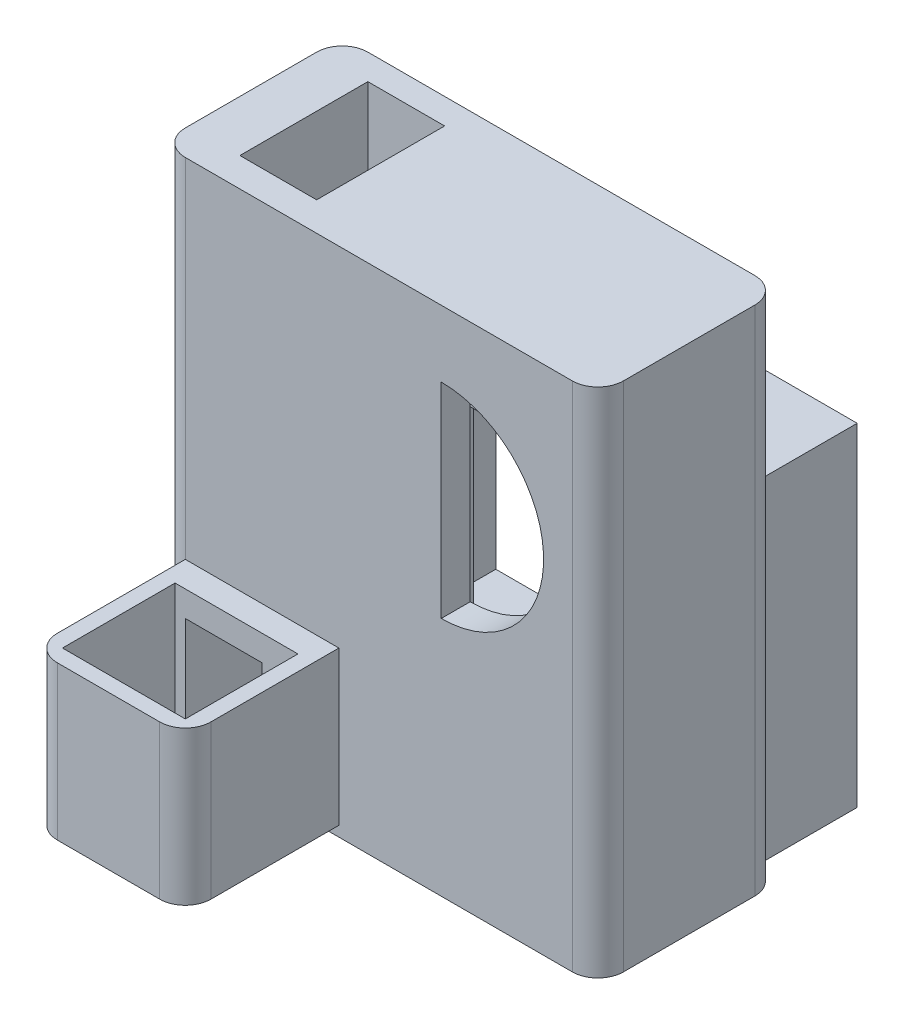
from build123d import *

# Parameters (mm, degrees)
CROQUIS1_W                 = 85.6
CROQUIS1_H                 = 35.66
SALIENTE_EXTRUIR1_DEPTH    = 100
CROQUIS2_W                 = 15
CROQUIS2_H                 = 25
CORTAR_EXTRUIR1_DEPTH      = 92
CROQUIS3_W                 = 30
CROQUIS3_H                 = 30
SALIENTE_EXTRUIR2_DEPTH    = 30
CROQUIS4_W                 = 24
CROQUIS4_H                 = 22
CORTAR_EXTRUIR2_DEPTH      = 30
REDONDEO1_R                = 5
CROQUIS8_W                 = 75.6
CROQUIS8_H                 = 65
SALIENTE_EXTRUIR3_DEPTH    = 20
CORTAR_EXTRUIR3_DEPTH      = 10
CORTAR_EXTRUIR3_DEPTH_BACK = 10
CROQUIS6_W                 = 15
CROQUIS6_H                 = 20
CROQUIS9_W                 = 24
CROQUIS9_H                 = 22
SALIENTE_EXTRUIR4_DEPTH    = 2
SALIENTE_EXTRUIR4_TAPER    = 60
CROQUIS10_W                = 17.07179677
CROQUIS10_H                = 15.07179677
CORTAR_EXTRUIR4_DEPTH      = 2
CORTAR_EXTRUIR4_DRAFT      = 25
CROQUIS12_W                = 65.6
CROQUIS12_H                = 55
CORTAR_EXTRUIR6_DEPTH      = 20
CROQUIS17_W                = 30
CROQUIS17_H                = 55
CORTAR_EXTRUIR11_DEPTH     = 30
CORTAR_EXTRUIR18_DEPTH     = 20
CORTAR_EXTRUIR19_DEPTH     = 5.66
CORTAR_EXTRUIR20_DEPTH     = 20


with BuildPart() as part:
    # Croquis1 → Saliente-Extruir1 (new body)
    with BuildSketch(Plane(origin=(0, 0, 0), x_dir=(1, 0, 0), z_dir=(0, 1, 0))):
        Rectangle(CROQUIS1_W, CROQUIS1_H)
    extrude(amount=SALIENTE_EXTRUIR1_DEPTH)

    # Croquis2 → Cortar-Extruir1 (cut)
    with BuildSketch(Plane(origin=(0, 100, 0), x_dir=(1, 0, 0), z_dir=(0, 1, 0))):
        with Locations((-25.3, 0.33)):
            Rectangle(CROQUIS2_W, CROQUIS2_H)
    extrude(amount=-CORTAR_EXTRUIR1_DEPTH, mode=Mode.SUBTRACT)

    # Croquis3 → Saliente-Extruir2 (add)
    with BuildSketch(Plane.XY.offset(17.83)):
        with Locations((-22.8, 17)):
            Rectangle(CROQUIS3_W, CROQUIS3_H)
    extrude(amount=SALIENTE_EXTRUIR2_DEPTH)

    # Croquis4 → Cortar-Extruir2 (cut)
    with BuildSketch(Plane.XZ.offset(-2)):
        with Locations((-22.8, 33.83)):
            Rectangle(CROQUIS4_W, CROQUIS4_H)
    extrude(amount=-CORTAR_EXTRUIR2_DEPTH, mode=Mode.SUBTRACT)

    # Redondeo1
    redondeo1_edges = [part.edges().sort_by_distance(p)[0] for p in [
        (-7.8, 17, 47.83),
        (-37.8, 17, 47.83),
        (42.8, 50, 17.83),
        (-42.8, 50, 17.83),
        (-42.8, 50, -17.83),
        (42.8, 50, -17.83),
    ]]
    fillet(redondeo1_edges, radius=REDONDEO1_R - 0.0001)  # a hair under: the kernel refuses the full size

    # Croquis8 → Saliente-Extruir3 (add)
    with BuildSketch(Plane(origin=(0, 0, -17.83), x_dir=(-1, 0, 0), z_dir=(0, 0, -1))):
        with Locations((0, 32.5)):
            Rectangle(CROQUIS8_W, CROQUIS8_H)
    extrude(amount=SALIENTE_EXTRUIR3_DEPTH)

    # Croquis6 → Cortar-Extruir3 (cut, two sides: drawn at the far end of the back side and taken through both)
    with BuildSketch(Plane.XY.offset(17.83).offset(-CORTAR_EXTRUIR3_DEPTH_BACK)):
        with Locations((-25.3, 17)):
            Rectangle(CROQUIS6_W, CROQUIS6_H)
    extrude(amount=CORTAR_EXTRUIR3_DEPTH + CORTAR_EXTRUIR3_DEPTH_BACK, mode=Mode.SUBTRACT)

    # Croquis12 → Cortar-Extruir6 (cut)
    with BuildSketch(Plane(origin=(0, 0, -37.83), x_dir=(-1, 0, 0), z_dir=(0, 0, -1))):
        with Locations((0, 32.5)):
            Rectangle(CROQUIS12_W, CROQUIS12_H)
    extrude(amount=-CORTAR_EXTRUIR6_DEPTH, mode=Mode.SUBTRACT)

    # Croquis17 → Cortar-Extruir11 (cut)
    with BuildSketch(Plane(origin=(0, 0, -17.83), x_dir=(-1, 0, 0), z_dir=(0, 0, -1))):
        with Locations((-17.8, 32.5)):
            Rectangle(CROQUIS17_W, CROQUIS17_H)
    extrude(amount=-CORTAR_EXTRUIR11_DEPTH, mode=Mode.SUBTRACT)

    # Croquis19 → Cortar-Extruir18 (cut)
    with BuildSketch(Plane(origin=(0, 0, 12.17), x_dir=(-1, 0, 0), z_dir=(0, 0, -1))):
        with BuildLine():
            Line((-32.8, 60), (-22.164916731, 60))
            ThreePointArc((-22.164916731, 60), (-18.611388301, 77.247448714), (-2.8, 85))
            Line((-2.8, 85), (-32.8, 85))
            Line((-32.8, 85), (-32.8, 60))
        make_face()
        with BuildLine():
            ThreePointArc((-22.164916731, 60), (-15.047448714, 49.188611699), (-2.8, 45))
            Line((-2.8, 45), (-2.8, 60))
            Line((-2.8, 60), (-22.164916731, 60))
        make_face()
        with BuildLine():
            Line((-22.164916731, 60), (-2.8, 60))
            Line((-2.8, 60), (-2.8, 85))
            ThreePointArc((-2.8, 85), (-18.611388301, 77.247448714), (-22.164916731, 60))
        make_face()
    extrude(amount=CORTAR_EXTRUIR18_DEPTH, mode=Mode.SUBTRACT)

    # Croquis20 → Cortar-Extruir19 (cut)
    with BuildSketch(Plane.XY.offset(17.83)):
        with BuildLine():
            ThreePointArc((12.2, 87), (32.2, 67), (12.2, 47))
            Line((12.2, 47), (12.2, 87))
        make_face()
    extrude(amount=-CORTAR_EXTRUIR19_DEPTH, mode=Mode.SUBTRACT)

    # Croquis21 → Cortar-Extruir20 (cut)
    with BuildSketch(Plane(origin=(2.8, 0, 0), x_dir=(0, 0, -1), z_dir=(1, 0, 0))):
        Polygon((17.83, 5), (17.83, 60), (7.83, 60), (7.83, 85), (-12.17, 85), (-12.17, 5), align=None)
    extrude(amount=-CORTAR_EXTRUIR20_DEPTH, mode=Mode.SUBTRACT)


with BuildPart() as body_2:
    # Croquis9 → Saliente-Extruir4 (new body)
    with BuildSketch(Plane.XZ.offset(-2)):
        with Locations((-22.8, 33.83)):
            Rectangle(CROQUIS9_W, CROQUIS9_H)
    extrude(amount=SALIENTE_EXTRUIR4_DEPTH, taper=SALIENTE_EXTRUIR4_TAPER)


with BuildPart() as cortar_extruir4_tool:
    # Croquis10 → Cortar-Extruir4 (with draft: the straight prism first)
    with BuildSketch(Plane.XZ):
        with Locations((-22.8, 33.83)):
            Rectangle(CROQUIS10_W, CROQUIS10_H)
    extrude(amount=-CORTAR_EXTRUIR4_DEPTH)
    # Cortar-Extruir4: the draft: its side faces are tilted about the plane it starts from
    cortar_extruir4_sides = [cortar_extruir4_tool.faces().sort_by_distance(p)[0] for p in [
        (-22.8, 1, 26.294101615),
        (-14.264101615, 1, 33.83),
        (-22.8, 1, 41.365898385),
        (-31.335898385, 1, 33.83),
    ]]
    draft(cortar_extruir4_sides, Plane.XZ, CORTAR_EXTRUIR4_DRAFT)


with BuildPart() as body_2_1:
    add(body_2.part)

    # Cortar-Extruir4: cut by cortar_extruir4_tool
    add(cortar_extruir4_tool.part, mode=Mode.SUBTRACT)


solid = Compound([part.part, body_2_1.part])
